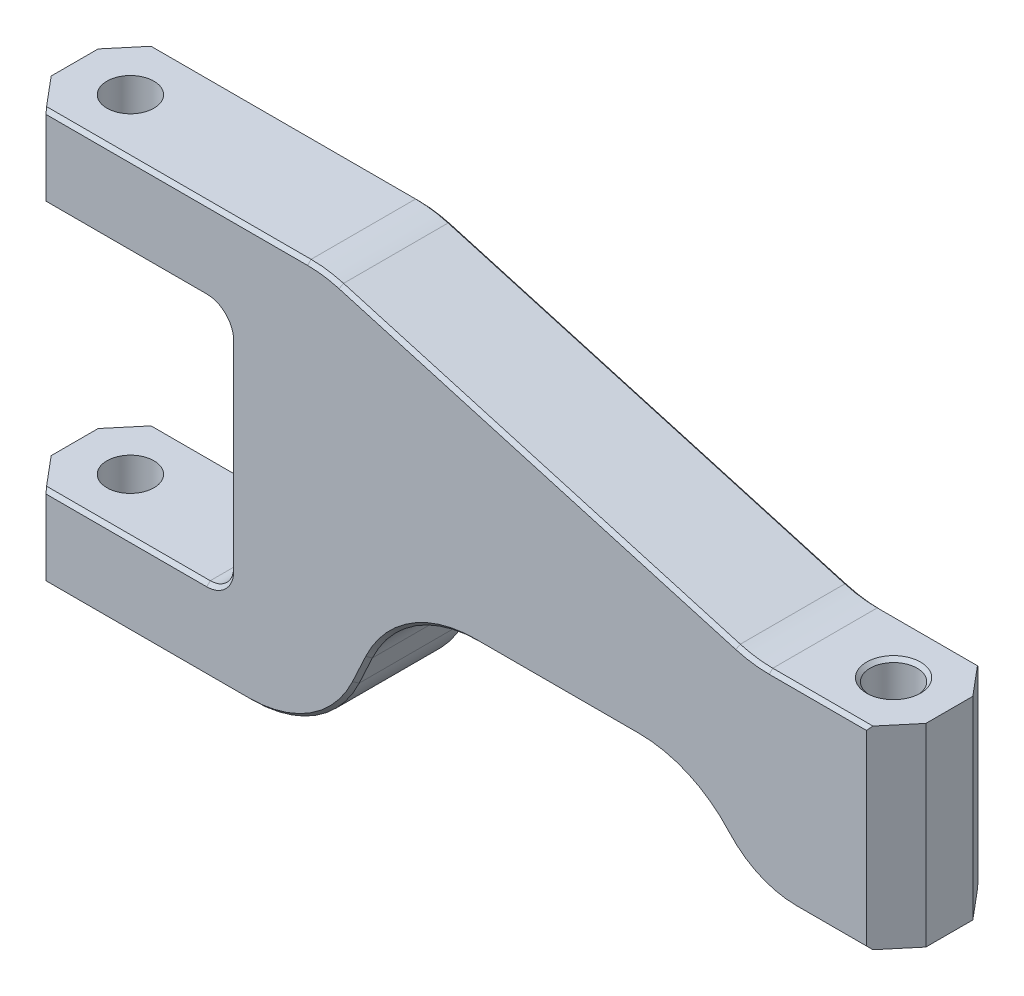
from build123d import *
from OCP.BRepFilletAPI import BRepFilletAPI_MakeChamfer

# Parameters (mm, degrees)
BOSS_EXTRUDE1_DEPTH = 9.5
SKETCH2_R           = 2
CUT_EXTRUDE1_DEPTH  = 44
CHAMFER3_SIZE       = 2.31
CHAMFER3_SIZE2      = 2.75
CHAMFER4_SIZE       = 2.75
CHAMFER4_SIZE2      = 2.31
FILLET2_R           = 2
FILLET3_R           = 10
FILLET4_R           = 8
CHAMFER5_SIZE       = 0.3


with BuildPart() as part:
    # Sketch1 → Boss-Extrude1 (new body)
    with BuildSketch(Plane.XY):
        Polygon((25.25, -9.5), (37.25, -9.5), (37.25, 7), (25.25, 7), (-11.25, 17.5), (-37.25, 17.5), (-37.25, 10.5), (-19.25, 10.5), (-19.25, -10.5), (-37.25, -10.5), (-37.25, -17.5), (-11.25, -17.5), (-4.75, -3.5), (20.25, -3.5), align=None)
    extrude(amount=BOSS_EXTRUDE1_DEPTH)

    # Sketch2 → Cut-Extrude1 (cut)
    with BuildSketch(Plane.XZ.offset(17.5)):
        with Locations((-32.5, 4.75)):
            Circle(SKETCH2_R)
        with Locations((32.5, 4.75)):
            Circle(SKETCH2_R)
    extrude(amount=-CUT_EXTRUDE1_DEPTH, mode=Mode.SUBTRACT)

    # Chamfer3: one chamfer whose edges measure the first distance from different faces: ONE call of the kernel's chamfer builder (chamfer() names one face for all edges)
    chamfer3_edges_1 = [part.edges().sort_by_distance(p)[0] for p in [
        (-37.25, 14, 0),
        (-37.25, -14, 0),
    ]]
    chamfer3_side_1 = [part.faces().sort_by_distance(p)[0] for p in [
        (-1.759689035, 1.451005524, 0),
    ]]
    chamfer3_edges_2 = [part.edges().sort_by_distance(p)[0] for p in [
        (37.25, -1.25, 9.5),
    ]]
    chamfer3_side_2 = [part.faces().sort_by_distance(p)[0] for p in [
        (-1.759689035, 1.451005524, 9.5),
    ]]
    chamfer3 = BRepFilletAPI_MakeChamfer(part.part.solid().wrapped)
    for e in chamfer3_edges_1:
        chamfer3.Add(CHAMFER3_SIZE, CHAMFER3_SIZE2, e.wrapped, chamfer3_side_1[0].wrapped)  # the first distance lies on this face
    for e in chamfer3_edges_2:
        chamfer3.Add(CHAMFER3_SIZE, CHAMFER3_SIZE2, e.wrapped, chamfer3_side_2[0].wrapped)  # the first distance lies on this face
    add(Compound.cast(chamfer3.Shape()), mode=Mode.REPLACE)

    # Chamfer4: one chamfer whose edges measure the first distance from different faces: ONE call of the kernel's chamfer builder (chamfer() names one face for all edges)
    chamfer4_edges_1 = [part.edges().sort_by_distance(p)[0] for p in [
        (37.25, -1.25, 0),
    ]]
    chamfer4_side_1 = [part.faces().sort_by_distance(p)[0] for p in [
        (37.25, -1.25, 3.375),
    ]]
    chamfer4_edges_2 = [part.edges().sort_by_distance(p)[0] for p in [
        (-37.25, -14, 9.5),
    ]]
    chamfer4_side_2 = [part.faces().sort_by_distance(p)[0] for p in [
        (-37.25, -14, 6.125),
    ]]
    chamfer4_edges_3 = [part.edges().sort_by_distance(p)[0] for p in [
        (-37.25, 14, 9.5),
    ]]
    chamfer4_side_3 = [part.faces().sort_by_distance(p)[0] for p in [
        (-37.25, 14, 6.125),
    ]]
    chamfer4 = BRepFilletAPI_MakeChamfer(part.part.solid().wrapped)
    for e in chamfer4_edges_1:
        chamfer4.Add(CHAMFER4_SIZE, CHAMFER4_SIZE2, e.wrapped, chamfer4_side_1[0].wrapped)  # the first distance lies on this face
    for e in chamfer4_edges_2:
        chamfer4.Add(CHAMFER4_SIZE, CHAMFER4_SIZE2, e.wrapped, chamfer4_side_2[0].wrapped)  # the first distance lies on this face
    for e in chamfer4_edges_3:
        chamfer4.Add(CHAMFER4_SIZE, CHAMFER4_SIZE2, e.wrapped, chamfer4_side_3[0].wrapped)  # the first distance lies on this face
    add(Compound.cast(chamfer4.Shape()), mode=Mode.REPLACE)

    # Fillet2
    fillet2_edges = [part.edges().sort_by_distance(p)[0] for p in [
        (-19.25, -10.5, 4.75),
        (-19.25, 10.5, 4.75),
    ]]
    fillet(fillet2_edges, radius=FILLET2_R)

    # Fillet3
    fillet3_edges = [part.edges().sort_by_distance(p)[0] for p in [
        (-11.25, -17.5, 4.75),
        (-4.75, -3.5, 4.75),
        (20.25, -3.5, 4.75),
        (25.25, 7, 4.75),
        (-11.25, 17.5, 4.75),
    ]]
    fillet(fillet3_edges, radius=FILLET3_R)

    # Fillet4
    fillet4_edges = [part.edges().sort_by_distance(p)[0] for p in [
        (25.25, -9.5, 4.75),
    ]]
    fillet(fillet4_edges, radius=FILLET4_R)

    # Chamfer5
    chamfer5_edges = [part.edges().sort_by_distance(p)[0] for p in [
        (30.5, 7, 4.75),
        (30.5, -9.5, 4.75),
        (-28.095, 10.5, 0),
        (-28.095, -10.5, 0),
        (-19.835786438, 9.914213562, 0),
        (-19.835786438, -9.914213562, 0),
        (-19.25, 0, 0),
        (-28.095, 10.5, 9.5),
        (-28.095, -10.5, 9.5),
        (-19.835786438, 9.914213562, 9.5),
        (-19.835786438, -9.914213562, 9.5),
        (-19.25, 0, 9.5),
        (-23.799884776, 17.5, 0),
        (30.799884776, 7, 0),
        (-11.263803813, 17.402084612, 0),
        (25.263803813, 7.097915388, 0),
        (7, 12.25, 0),
        (-23.799884776, 17.5, 9.5),
        (30.799884776, 7, 9.5),
        (-11.263803813, 17.402084612, 9.5),
        (25.263803813, 7.097915388, 9.5),
        (7, 12.25, 9.5),
        (-26.286196086, -17.5, 0),
        (31.961329203, -9.5, 0),
        (-12.252388949, -15.929446324, 0),
        (25.716672081, -8.802967433, 0),
        (-8, -10.5, 0),
        (19.648733445, -4.371290708, 0),
        (-3.747611051, -5.070553676, 0),
        (8.599321356, -3.5, 0),
        (-26.286196086, -17.5, 9.5),
        (31.961329203, -9.5, 9.5),
        (-12.252388949, -15.929446324, 9.5),
        (25.716672081, -8.802967433, 9.5),
        (-8, -10.5, 9.5),
        (19.648733445, -4.371290708, 9.5),
        (-3.747611051, -5.070553676, 9.5),
        (8.599321356, -3.5, 9.5),
    ]]
    chamfer(chamfer5_edges, length=CHAMFER5_SIZE)


solid = part.part
